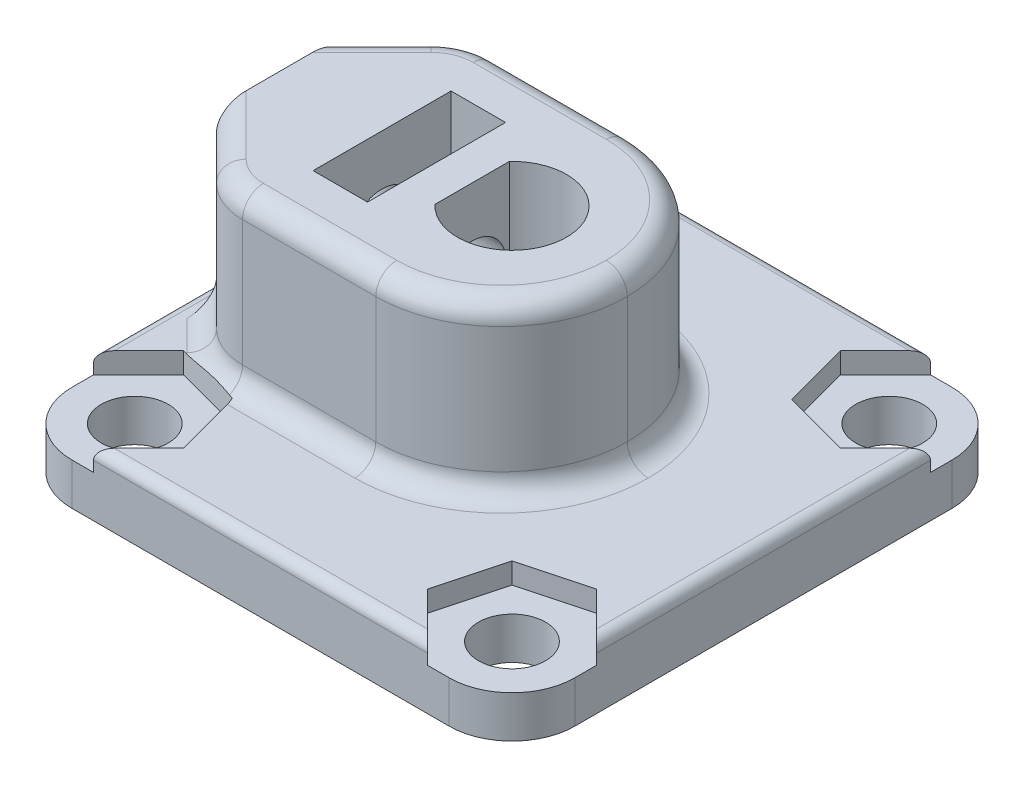
from build123d import *

# Parameters (mm, degrees)
SKETCH1_W            = 24
SKETCH1_H            = 24
BOSS_EXTRUDE1_DEPTH  = 3
SKETCH2_W            = 16.6
SKETCH2_H            = 12
BOSS_EXTRUDE2_DEPTH  = 8
CUT_EXTRUDE1_DEPTH   = 21.223748416
CUT_EXTRUDE2_REACH   = 30.26
SKETCH4_R            = 1.6
CUT_EXTRUDE3_DEPTH   = 1.3
FILLET3_R            = 6
CHAMFER3_SIZE        = 3
FILLET4_R            = 3
FILLET6_R            = 1
SKETCH9_R            = 1.6
CUT_EXTRUDE5_DEPTH   = 19.761663039
FILLET8_R            = 3
FILLET9_R            = 0.5
CUT_EXTRUDE6_START   = -1
CUT_EXTRUDE6_DEPTH   = 20.761663103
MIRROR2_START        = -1
MIRROR2_COPY_1_DEPTH = 20.761663103


with BuildPart() as part:
    # Sketch1 → Boss-Extrude1 (new body)
    with BuildSketch(Plane(origin=(0, 0, 0), x_dir=(1, 0, 0), z_dir=(0, 1, 0))):
        Rectangle(SKETCH1_W, SKETCH1_H)
    extrude(amount=BOSS_EXTRUDE1_DEPTH)

    # Sketch2 → Boss-Extrude2 (add)
    with BuildSketch(Plane(origin=(0, 3, 0), x_dir=(1, 0, 0), z_dir=(0, 1, 0))):
        with Locations((-2.8, 0)):
            Rectangle(SKETCH2_W, SKETCH2_H)
    extrude(amount=BOSS_EXTRUDE2_DEPTH)

    # Sketch3 → Cut-Extrude1 (cut, through all)
    with BuildSketch(Plane(origin=(0, 11, 0), x_dir=(1, 0, 0), z_dir=(0, 1, 0))):
        with BuildLine():
            Line((-1.9, 1.774823935), (-1.9, -1.774823935))
            ThreePointArc((-1.9, -1.774823935), (2.6, 0), (-1.9, 1.774823935))
        make_face()
    extrude(amount=-CUT_EXTRUDE1_DEPTH, mode=Mode.SUBTRACT)

    # Sketch4 → Cut-Extrude2 (cut, up to next)
    with BuildSketch(Plane.ZY.offset(11.1), mode=Mode.PRIVATE) as cut_extrude2_sk1:
        with Locations((0, 7)):
            Circle(SKETCH4_R)
    cut_extrude2_tool1 = extrude(cut_extrude2_sk1.sketch, amount=-CUT_EXTRUDE2_REACH, mode=Mode.PRIVATE) & part.part
    add(cut_extrude2_tool1.solids().sort_by_distance((-11.1, 7, 0))[0], mode=Mode.SUBTRACT)

    # Sketch5 → Cut-Extrude3 (cut, symmetric)
    with BuildSketch(Plane(origin=(-4.9, 0, 0), x_dir=(0, 0, -1), z_dir=(1, 0, 0))):
        Polygon((1.645448267, 4.15), (3.290896534, 7), (3.290896534, 11), (-3.290896534, 11), (-3.290896534, 7), (-1.645448267, 4.15), align=None)
    extrude(amount=CUT_EXTRUDE3_DEPTH, both=True, mode=Mode.SUBTRACT)

    # Fillet3
    fillet3_edges = [part.edges().sort_by_distance(p)[0] for p in [
        (5.5, 7, 6),
        (5.5, 7, -6),
    ]]
    fillet(fillet3_edges, radius=FILLET3_R - 0.0001)  # a hair under: the kernel refuses the full size

    # Chamfer3
    chamfer3_edges = [part.edges().sort_by_distance(p)[0] for p in [
        (-11.1, 7, -6),
        (-11.1, 7, 6),
    ]]
    chamfer(chamfer3_edges, length=CHAMFER3_SIZE)

    # Fillet4
    fillet4_edges = [part.edges().sort_by_distance(p)[0] for p in [
        (-8.1, 7, -6),
        (-8.1, 7, 6),
    ]]
    fillet(fillet4_edges, radius=FILLET4_R)

    # Fillet6
    fillet6_edges = [part.edges().sort_by_distance(p)[0] for p in [
        (-3.678629656, 11, -6),
        (3.742669976, 11, -4.242669976),
        (3.742669976, 11, 4.242669976),
        (-3.678629656, 3, -6),
        (3.742669976, 3, 4.242669976),
        (3.742669976, 3, -4.242669976),
        (-10.039339828, 11, 4.060660172),
        (-10.039339828, 3, -4.060660172),
        (-3.678629656, 11, 6),
        (-3.678629656, 3, 6),
        (-10.039339828, 3, 4.060660172),
        (-10.039339828, 11, -4.060660172),
        (-8.00540961, 11, -5.771638598),
        (-8.00540961, 11, 5.771638598),
        (-8.00540961, 3, 5.771638598),
        (-8.00540961, 3, -5.771638598),
    ]]
    fillet(fillet6_edges, radius=FILLET6_R)

    # Sketch9 → Cut-Extrude5 (cut, through all)
    with BuildSketch(Plane(origin=(0, 3, 0), x_dir=(1, 0, 0), z_dir=(0, 1, 0))):
        with Locations(Location((-9, 9, 0), (0, 0, 270))):
            Circle(SKETCH9_R)
        with Locations(Location((9, 9, 0), (0, 0, 270))):
            Circle(SKETCH9_R)
        with Locations(Location((9, -9, 0), (0, 0, 270))):
            Circle(SKETCH9_R)
        with Locations(Location((-9, -9, 0), (0, 0, 270))):
            Circle(SKETCH9_R)
    extrude(amount=-CUT_EXTRUDE5_DEPTH, mode=Mode.SUBTRACT)

    # Fillet8
    fillet8_edges = [part.edges().sort_by_distance(p)[0] for p in [
        (-12, 1.5, -12),
        (12, 1.5, -12),
        (12, 1.5, 12),
        (-12, 1.5, 12),
    ]]
    fillet(fillet8_edges, radius=FILLET8_R)

    # Fillet9
    fillet9_edges = [part.edges().sort_by_distance(p)[0] for p in [
        (12, 3, 0),
        (0, 3, 12),
        (-12, 3, 0),
        (0, 3, -12),
        (-11.121320344, 3, 11.121320344),
        (-11.121320344, 3, -11.121320344),
        (11.121320344, 3, -11.121320344),
        (11.121320344, 3, 11.121320344),
    ]]
    fillet(fillet9_edges, radius=FILLET9_R)

    # Sketch10 → Cut-Extrude6 (cut)
    with BuildSketch(Plane(origin=(0, 3, 0), x_dir=(1, 0, 0), z_dir=(0, 1, 0)).offset(CUT_EXTRUDE6_START)):
        Polygon((5.821238046, -9.851746699), (8.148253301, -12.178761954), (9.106066017, -13.13657467), (13.13657467, -9.106066017), (12.178761954, -8.148253301), (9.851746699, -5.821238046), (6.672984744, -6.672984744), align=None)
    cut_extrude6 = extrude(amount=CUT_EXTRUDE6_DEPTH, mode=Mode.SUBTRACT)

    # Mirror1: Cut-Extrude6 across plane
    add(cut_extrude6.mirror(Plane.XY), mode=Mode.SUBTRACT)

    # Mirror2: Cut-Extrude6 across plane
    add(cut_extrude6.mirror(Plane(origin=(0, 0, 0), x_dir=(0, 0, 1), z_dir=(1, 0, 0))), mode=Mode.SUBTRACT)

    # Mirror2 copy 1 sketch → Mirror2 copy 1 (cut)
    with BuildSketch(Plane(origin=(0, 3, 0), x_dir=(-1, 0, 0), z_dir=(0, 1, 0)).offset(MIRROR2_START)):
        Polygon((5.821238046, -9.851746699), (8.148253301, -12.178761954), (9.106066017, -13.13657467), (13.13657467, -9.106066017), (12.178761954, -8.148253301), (9.851746699, -5.821238046), (6.672984744, -6.672984744), align=None)
    extrude(amount=MIRROR2_COPY_1_DEPTH, mode=Mode.SUBTRACT)


solid = part.part
